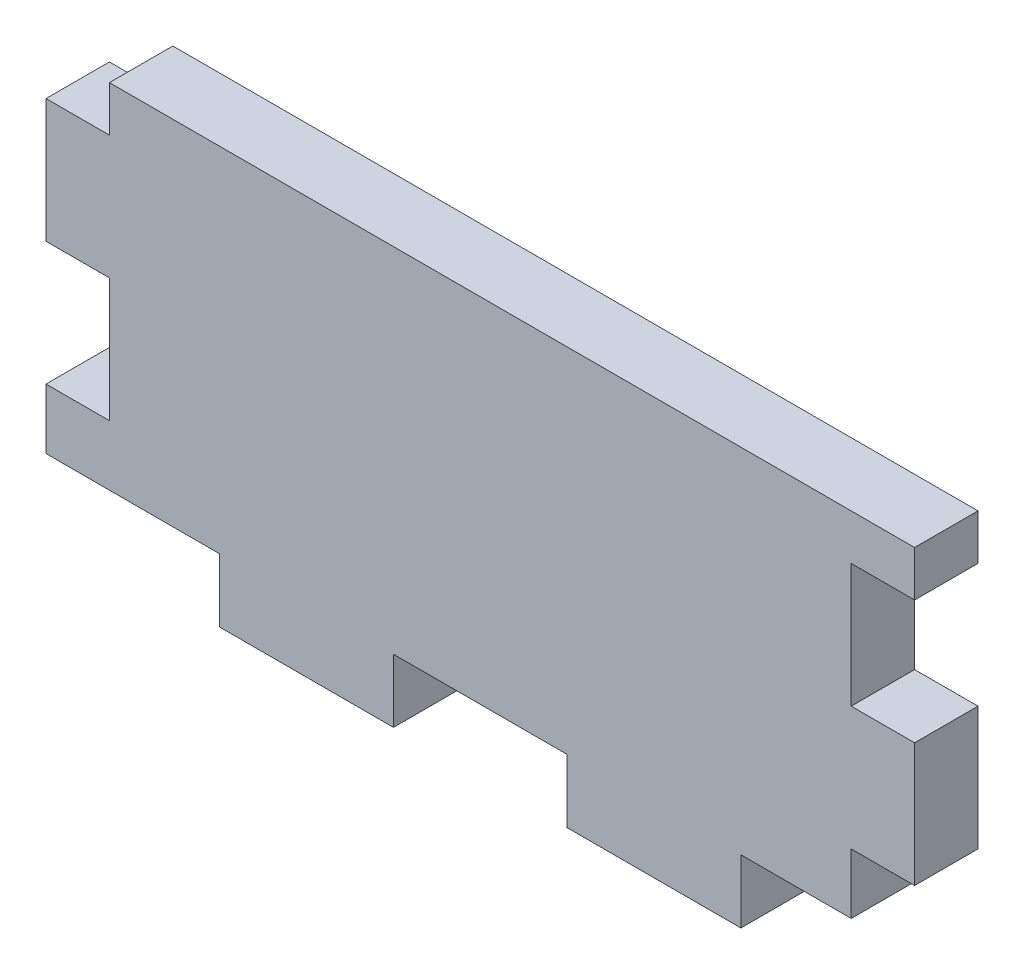
from build123d import *

# Parameters (mm, degrees)
BOSS_EXTRUDE1_DEPTH = 4.5593
CAVITY1_START       = -26.67
CAVITY1_OUTLINE_W   = 12.49172
CAVITY1_OUTLINE_H   = 4.5593
CAVITY1_OUTLINE_W_2 = 7.93242
CAVITY1_DEPTH       = 4.5593


# Read off the part's stored shape, not the designer's step: Cavity1
with BuildPart() as part:
    # Sketch1 → Boss-Extrude1 (new body)
    with BuildSketch(Plane.XY):
        Polygon((31.2293, 0), (31.2293, 3.27152), (-26.67, 3.27152), (-26.67, 0), (-31.2293, 0), (-31.2293, -8.89), (-26.67, -8.89), (-26.67, -17.78), (-31.2293, -17.78), (-31.2293, -26.67), (26.67, -26.67), (26.67, -17.78), (31.2293, -17.78), (31.2293, -8.89), (26.67, -8.89), (26.67, 0), align=None)
    extrude(amount=BOSS_EXTRUDE1_DEPTH)

    # Cavity1 outline → Cavity1 (cut)
    with BuildSketch(Plane(origin=(0, 0, 0), x_dir=(1, 0, 0), z_dir=(0, 1, 0)).offset(CAVITY1_START)):
        with Locations((-24.98344, -2.27965)):
            Rectangle(CAVITY1_OUTLINE_W, CAVITY1_OUTLINE_H)
        with Locations((0, -2.27965)):
            Rectangle(CAVITY1_OUTLINE_W, CAVITY1_OUTLINE_H)
        with Locations((22.70379, -2.27965)):
            Rectangle(CAVITY1_OUTLINE_W_2, CAVITY1_OUTLINE_H)
    extrude(amount=CAVITY1_DEPTH, mode=Mode.SUBTRACT)


solid = part.part
